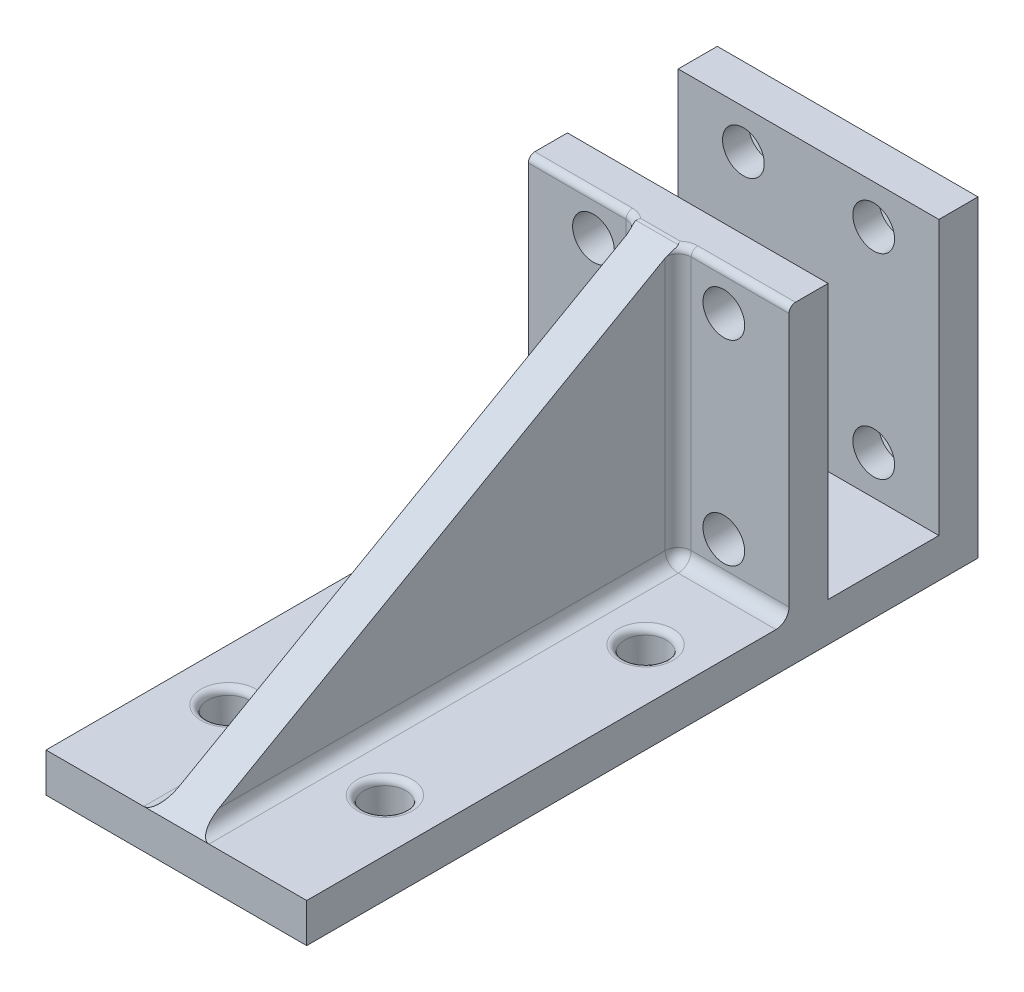
from build123d import *

# Parameters (mm, degrees)
EXTRUDE_1_DEPTH          = 10
RIB_1_REACH              = 49.707
SKETCH_3_WALL_W          = 139.958978308
SKETCH_3_WALL_H          = 3
EXTRUDE_2_DEPTH          = 20
CUT_EXTRUDE_1_DEPTH      = 46.221676218
CUT_EXTRUDE_1_DEPTH_BACK = 46.221676218
SKETCH_4_R               = 1.6
FILLET_1_R               = 1
CUT_EXTRUDE_2_DEPTH      = 47.270941205
CUT_EXTRUDE_2_DEPTH_BACK = 47.270941205
SKETCH_6_R               = 1.6
FILLET_2_R               = 0.5
FILLET_START             = 2.5
FILLET_3_3_DEPTH         = 8.5
FILLET_START_2           = -11
FILLET_3_4_DEPTH         = 8.5
FILLET_START_3           = -2.5
FILLET_3_5_DEPTH         = 5
CUT_EXTRUDE_3_DEPTH      = 1


with BuildPart() as part:
    # 草图1 → 凸台-拉伸1 (new, symmetric)
    with BuildSketch(Plane(origin=(0, 0, 0), x_dir=(0, 0, -1), z_dir=(1, 0, 0))):
        Polygon((0, 24), (0, 0), (-40, 0), (-40, 3), (-3, 3), (-3, 24), align=None)
    extrude(amount=EXTRUDE_1_DEPTH, both=True)

    # 草图3 wall → 筋1 (add, up to next)
    with BuildSketch(Plane(origin=(0, 13.5, 21.5), x_dir=(0, -0.493605519458, 0.869685915236), z_dir=(0, -0.869685915236, -0.493605519458)), mode=Mode.PRIVATE) as rib_1_sk1:
        Rectangle(SKETCH_3_WALL_W, SKETCH_3_WALL_H)
    rib_1_tool1 = extrude(rib_1_sk1.sketch, amount=RIB_1_REACH, mode=Mode.PRIVATE) - part.part
    add(rib_1_tool1.solids().sort_by_distance((0, 13.5, 21.5))[0])

    # 草图5 → 凸台-拉伸2 (add)
    with BuildSketch(Plane.ZY.offset(10)):
        Polygon((0, 0), (-11.5, 0), (-11.5, 3), (-11.5, 24), (-8.5, 24), (-8.5, 3), (0, 3), align=None)
    extrude(amount=-EXTRUDE_2_DEPTH)

    # 草图4 → 切除-拉伸1 (cut, two sides: drawn at the far end of the back side and taken through both)
    with BuildSketch(Plane.XY.offset(3).offset(-CUT_EXTRUDE_1_DEPTH_BACK)):
        with Locations((-5, 21)):
            Circle(SKETCH_4_R)
        with Locations((-5, 6)):
            Circle(SKETCH_4_R)
        with Locations((5, 21)):
            Circle(SKETCH_4_R)
        with Locations((5, 6)):
            Circle(SKETCH_4_R)
    extrude(amount=CUT_EXTRUDE_1_DEPTH + CUT_EXTRUDE_1_DEPTH_BACK, mode=Mode.SUBTRACT)

    # 圆角1
    fillet_1_edges = [part.edges().sort_by_distance(p)[0] for p in [
        (5.75, 3, 3),
        (-5.75, 3, 3),
        (-1.5, 13.5, 3),
        (-1.5, 3, 21.5),
        (1.5, 13.5, 3),
        (1.5, 3, 21.5),
    ]]
    fillet(fillet_1_edges, radius=FILLET_1_R)

    # 草图6 → 切除-拉伸2 (cut, two sides: drawn at the far end of the back side and taken through both)
    with BuildSketch(Plane(origin=(0, 3, 0), x_dir=(1, 0, 0), z_dir=(0, 1, 0)).offset(-CUT_EXTRUDE_2_DEPTH_BACK)):
        with Locations(Location((-6, -10, 0), (0, 0, 270))):
            Circle(SKETCH_6_R)
        with Locations(Location((6, -10, 0), (0, 0, 270))):
            Circle(SKETCH_6_R)
        with Locations(Location((-6, -30, 0), (0, 0, 270))):
            Circle(SKETCH_6_R)
        with Locations(Location((6, -30, 0), (0, 0, 270))):
            Circle(SKETCH_6_R)
    extrude(amount=CUT_EXTRUDE_2_DEPTH + CUT_EXTRUDE_2_DEPTH_BACK, mode=Mode.SUBTRACT)

    # 圆角2
    fillet_2_edges = [part.edges().sort_by_distance(p)[0] for p in [
        (6, 3, 8.4),
        (-6, 3, 28.4),
        (6, 3, 28.4),
        (-6, 3, 8.4),
    ]]
    fillet(fillet_2_edges, radius=FILLET_2_R)

    # 圆角3: read off the stored shape, not the designer's step
    # 圆角3 outline → 圆角3 (revolve, cut)
    with BuildSketch(Plane(origin=(-2.5, 0, 4), x_dir=(1, 0, 0), z_dir=(0, 0, 1))):
        with BuildLine():
            Line((1, 24), (1, 23.5))
            ThreePointArc((1, 23.5), (1.146446609, 23.853553391), (1.5, 24))
            Line((1.5, 24), (1, 24))
        make_face()
    revolve(axis=Axis((-2.5, 0, 4), (0, 1, 0)), mode=Mode.SUBTRACT)

    # Fillet 3 2 outline → Fillet 3 2 (revolve, cut)
    with BuildSketch(Plane(origin=(2.5, 0, 4), x_dir=(1, 0, 0), z_dir=(0, 0, 1))):
        with BuildLine():
            Line((1, 24), (1, 23.5))
            ThreePointArc((1, 23.5), (1.146446609, 23.853553391), (1.5, 24))
            Line((1.5, 24), (1, 24))
        make_face()
    revolve(axis=Axis((2.5, 0, 4), (0, 1, 0)), mode=Mode.SUBTRACT)

    # Fillet 3 3 outline → Fillet 3 3 (cut)
    with BuildSketch(Plane.YZ.offset(FILLET_START)):
        with BuildLine():
            ThreePointArc((23.5, 3), (23.853553391, 2.853553391), (24, 2.5))
            Line((24, 2.5), (24, 3))
            Line((24, 3), (23.5, 3))
        make_face()
    extrude(amount=FILLET_3_3_DEPTH, mode=Mode.SUBTRACT)

    # Fillet 3 4 outline → Fillet 3 4 (cut)
    with BuildSketch(Plane.YZ.offset(FILLET_START_2)):
        with BuildLine():
            ThreePointArc((23.5, 3), (23.853553391, 2.853553391), (24, 2.5))
            Line((24, 2.5), (24, 3))
            Line((24, 3), (23.5, 3))
        make_face()
    extrude(amount=FILLET_3_4_DEPTH, mode=Mode.SUBTRACT)

    # Fillet 3 5 outline → Fillet 3 5 (cut)
    with BuildSketch(Plane.YZ.offset(FILLET_START_3)):
        with BuildLine():
            Line((24, 2.867997744), (24, 3))
            Line((24, 3), (23.934842958, 3.114800503))
            ThreePointArc((23.934842958, 3.114800503), (23.983436386, 2.995627131), (24, 2.867997744))
        make_face()
    extrude(amount=FILLET_3_5_DEPTH, mode=Mode.SUBTRACT)

    # 草图7 → 切除-拉伸3 (cut)
    with BuildSketch(Plane(origin=(0, 0, -11.5), x_dir=(-1, 0, 0), z_dir=(0, 0, -1))):
        Polygon((-5, 8.8), (-7.424871131, 7.4), (-7.424871131, 4.6), (-5, 3.2), (-2.575128869, 4.6), (-2.575128869, 7.4), align=None)
        Polygon((-5, 23.8), (-7.424871131, 22.4), (-7.424871131, 19.6), (-5, 18.2), (-2.575128869, 19.6), (-2.575128869, 22.4), align=None)
        Polygon((5, 23.8), (2.575128869, 22.4), (2.575128869, 19.6), (5, 18.2), (7.424871131, 19.6), (7.424871131, 22.4), align=None)
        Polygon((5, 8.8), (2.575128869, 7.4), (2.575128869, 4.6), (5, 3.2), (7.424871131, 4.6), (7.424871131, 7.4), align=None)
    extrude(amount=-CUT_EXTRUDE_3_DEPTH, mode=Mode.SUBTRACT)


solid = part.part
